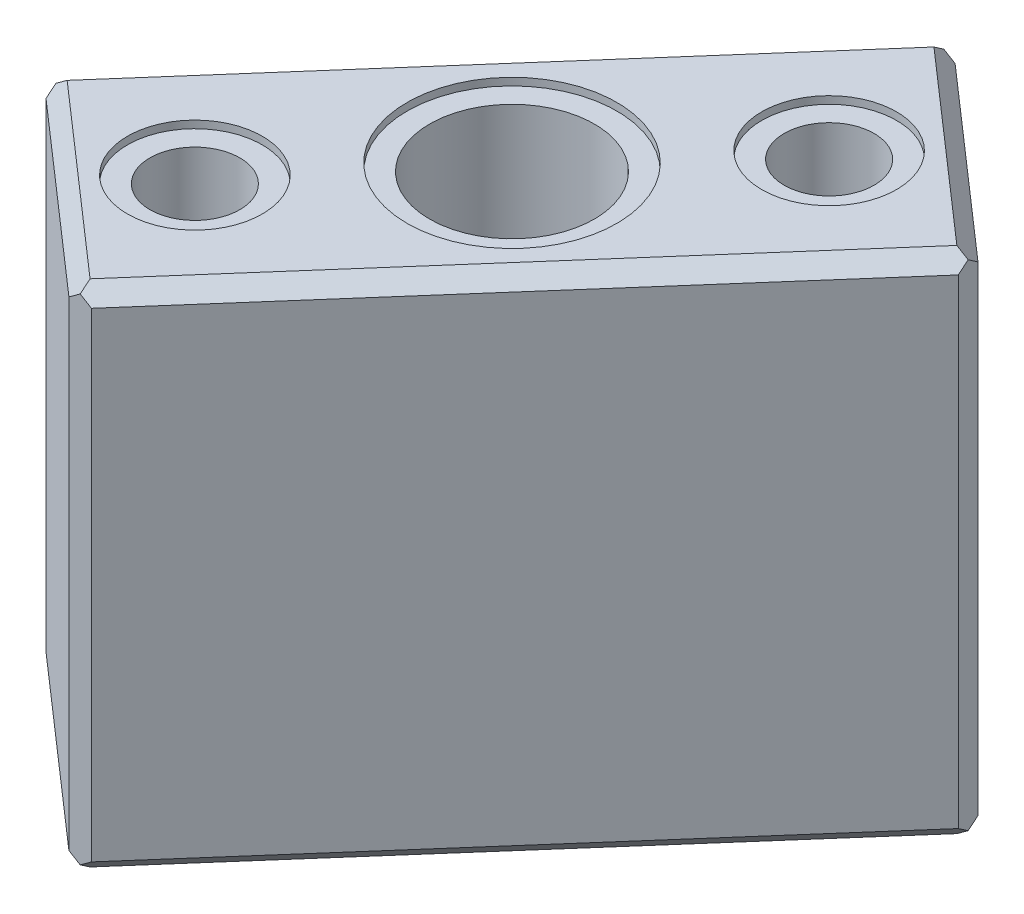
from build123d import *

# Parameters (mm, degrees)
BOSS_EXTRUDE1_START = -1.5
BOSS_EXTRUDE1_DEPTH = 17
CHAMFER1_SIZE       = 0.5
CHAMFER2_SIZE       = 0.5
SKETCH3_R           = 2.25
SKETCH3_R_2         = 3.5
CUT_EXTRUDE1_DEPTH  = 0.25
SKETCH4_R           = 1.5
SKETCH4_R_2         = 2.75
CUT_EXTRUDE2_DEPTH  = 10


with BuildPart() as part:
    # Sketch1 → Boss-Extrude1 (new body)
    with BuildSketch(Plane(origin=(0, 0, 0), x_dir=(1, 0, 0), z_dir=(0, 1, 0)).offset(BOSS_EXTRUDE1_START)):
        Polygon((-119.371877221, -118.892211925), (-105.214028152, -102.711812989), (-112.084182588, -96.700427857), (-126.242031658, -112.880826794), align=None)
    extrude(amount=-BOSS_EXTRUDE1_DEPTH)

    # Chamfer1
    chamfer1_edges = [part.edges().sort_by_distance(p)[0] for p in [
        (-119.371877221, -10, 118.892211925),
        (-105.214028152, -10, 102.711812989),
        (-112.084182588, -10, 96.700427857),
        (-126.242031658, -10, 112.880826794),
    ]]
    chamfer(chamfer1_edges, length=CHAMFER1_SIZE)

    # Chamfer2
    # the kernel refuses this chamfer: 0.5 mm, written as the material it takes off along each edge
    with BuildSketch(Plane(origin=(-104.622622158, -18.5, 103.229293234), x_dir=(-0.6582556384124536, -0.027495876610589123, 0.7522921581856536), z_dir=(-0.7525766947068745, 0, -0.6585046078685219)), Plane(origin=(-126.833437652, -18.5, 112.363346549), x_dir=(0.6582556384124544, -0.027495876610588624, -0.752292158185653), z_dir=(0.7525766947068739, 0, 0.6585046078685227))) as chamfer2_piece_1:
        Polygon((CHAMFER2_SIZE * 0.999621916911, CHAMFER2_SIZE * 0.0274958766106), (-CHAMFER2_SIZE * 0.0274958766106, CHAMFER2_SIZE * 0.999621916911), (0, 0), align=None)
    extrude(amount=10.700525914, mode=Mode.SUBTRACT)
    with BuildSketch(Plane(origin=(-111.566702344, -18.5, 96.109021863), x_dir=(0.7522921581856542, -0.027495876610589123, 0.6582556384124529), z_dir=(-0.6585046078685213, 0, 0.7525766947068752)), Plane(origin=(-119.889357466, -1.5, 119.483617919), x_dir=(0.02069275593768218, -0.9996219169112961, 0.018106161445472113), z_dir=(0.6585046078685223, 0, -0.7525766947068742))) as chamfer2_piece_2:
        Polygon((CHAMFER2_SIZE * 0.999621916911, CHAMFER2_SIZE * 0.0274958766106), (-CHAMFER2_SIZE * 0.0274958766106, CHAMFER2_SIZE * 0.999621916911), (0, 0), align=None)
    extrude(amount=23.071682988, mode=Mode.SUBTRACT)
    with BuildSketch(Plane(origin=(-119.889357466, -18.5, 119.483617919), x_dir=(0.020692755937682127, 0.9996219169112961, 0.018106161445472065), z_dir=(0.6585046078685223, 0, -0.7525766947068742)), Plane(origin=(-111.566702344, -1.5, 96.109021863), x_dir=(0.7522921581856542, 0.027495876610586535, 0.6582556384124529), z_dir=(-0.6585046078685213, 0, 0.7525766947068752))) as chamfer2_piece_3:
        Polygon((CHAMFER2_SIZE * 0.999621916911, -CHAMFER2_SIZE * 0.0274958766106), (-CHAMFER2_SIZE * 0.0274958766106, -CHAMFER2_SIZE * 0.999621916911), (0, 0), align=None)
    extrude(amount=23.071682988, mode=Mode.SUBTRACT)
    with BuildSketch(Plane(origin=(-104.622622158, -1.5, 103.229293234), x_dir=(-0.6582556384124536, 0.027495876610586965, 0.7522921581856536), z_dir=(-0.7525766947068745, 0, -0.6585046078685219)), Plane(origin=(-126.833437652, -1.5, 112.363346549), x_dir=(0.6582556384124544, 0.027495876610586036, -0.752292158185653), z_dir=(0.7525766947068739, 0, 0.6585046078685227))) as chamfer2_piece_4:
        Polygon((CHAMFER2_SIZE * 0.999621916911, -CHAMFER2_SIZE * 0.0274958766106), (-CHAMFER2_SIZE * 0.0274958766106, -CHAMFER2_SIZE * 0.999621916911), (0, 0), align=None)
    extrude(amount=10.700525914, mode=Mode.SUBTRACT)

    # Sketch3 → Cut-Extrude1 (cut)
    with BuildSketch(Plane(origin=(0, -1.5, 0), x_dir=(1, 0, 0), z_dir=(0, 1, 0))):
        with Locations(Location((-110.789245346, -102.151994681, 0), (0, 0, 270))):
            Circle(SKETCH3_R)
        with Locations(Location((-115.728029905, -107.796319891, 0), (0, 0, 270))):
            Circle(SKETCH3_R_2)
        with Locations(Location((-120.666814464, -113.440645102, 0), (0, 0, 270))):
            Circle(SKETCH3_R)
    extrude(amount=-CUT_EXTRUDE1_DEPTH, mode=Mode.SUBTRACT)

    # Sketch4 → Cut-Extrude2 (cut)
    with BuildSketch(Plane(origin=(0, -1.5, 0), x_dir=(1, 0, 0), z_dir=(0, 1, 0))):
        with Locations(Location((-110.789245346, -102.151994681, 0), (0, 0, 270))):
            Circle(SKETCH4_R)
        with Locations(Location((-115.728029905, -107.796319891, 0), (0, 0, 270))):
            Circle(SKETCH4_R_2)
        with Locations(Location((-120.666814464, -113.440645102, 0), (0, 0, 270))):
            Circle(SKETCH4_R)
    extrude(amount=-CUT_EXTRUDE2_DEPTH, mode=Mode.SUBTRACT)


solid = part.part
